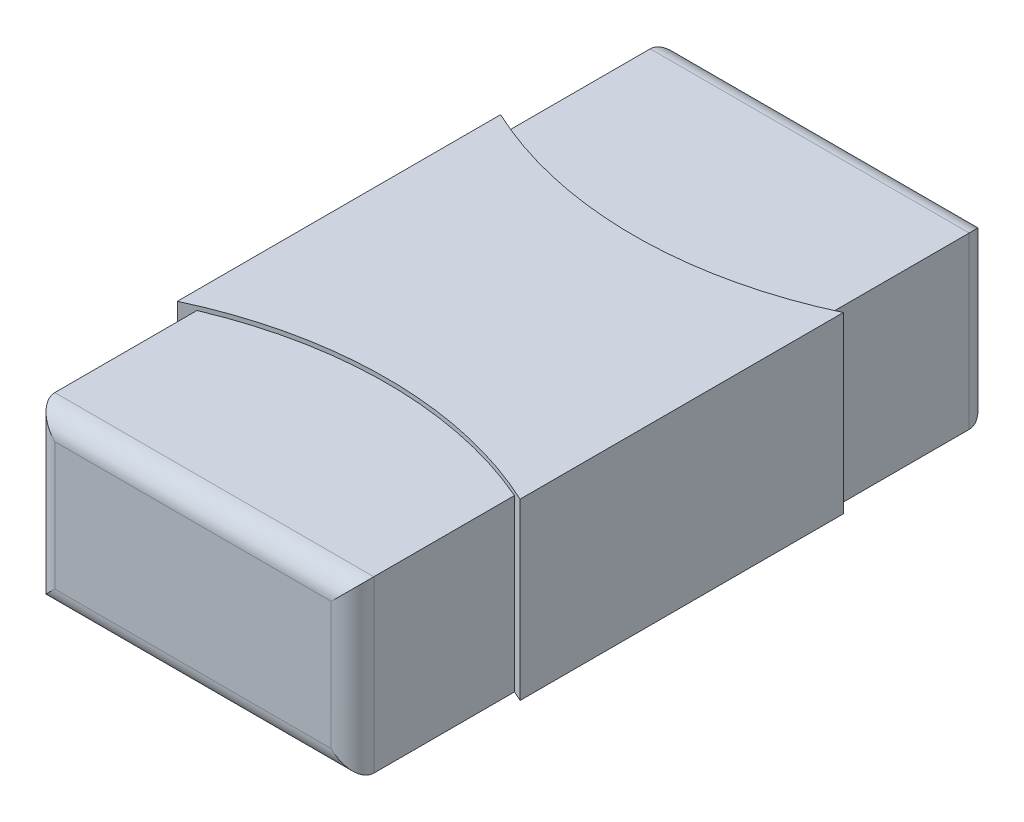
from build123d import *

# Parameters (mm, degrees)
ESQUISSE1_W             = 1.5
ESQUISSE1_H             = 3
BOSS_EXTRU_1_DEPTH      = 0.8
CONG_1_R                = 0.1
BOSS_EXTRU_2_DEPTH      = 0.02
BOSS_EXTRU_2_DEPTH_BACK = 0.8


with BuildPart() as part:
    # Esquisse1 → Boss.-Extru.1 (new body)
    with BuildSketch(Plane(origin=(0, 0, 0), x_dir=(1, 0, 0), z_dir=(0, 1, 0))):
        Rectangle(ESQUISSE1_W, ESQUISSE1_H)
    extrude(amount=BOSS_EXTRU_1_DEPTH)

    # Congé1
    cong_1_edges = [part.edges().sort_by_distance(p)[0] for p in [
        (0.75, 0.4, -1.5),
        (0, 0.8, -1.5),
        (-0.75, 0.4, -1.5),
        (0, 0, -1.5),
        (-0.75, 0.4, 1.5),
        (0, 0.8, 1.5),
        (0.75, 0.4, 1.5),
        (0, 0, 1.5),
    ]]
    fillet(cong_1_edges, radius=CONG_1_R)

    # Esquisse2 → Boss.-Extru.2 (add, two sides: drawn at the far end of the back side and taken through both)
    with BuildSketch(Plane(origin=(0, 0.8, 0), x_dir=(1, 0, 0), z_dir=(0, 1, 0)).offset(-BOSS_EXTRU_2_DEPTH_BACK)):
        with BuildLine():
            Line((-0.813673936, -0.759907702), (-0.813673936, 0.759907702))
            ThreePointArc((-0.813673936, 0.759907702), (-0.007860433, 0.580975839), (0.797952705, 0.759909342))
            Line((0.797952705, 0.759909342), (0.797952705, -0.759909342))
            ThreePointArc((0.797952705, -0.759909342), (-0.007860433, -0.580975839), (-0.813673936, -0.759907702))
        make_face()
    extrude(amount=BOSS_EXTRU_2_DEPTH + BOSS_EXTRU_2_DEPTH_BACK)


solid = part.part
